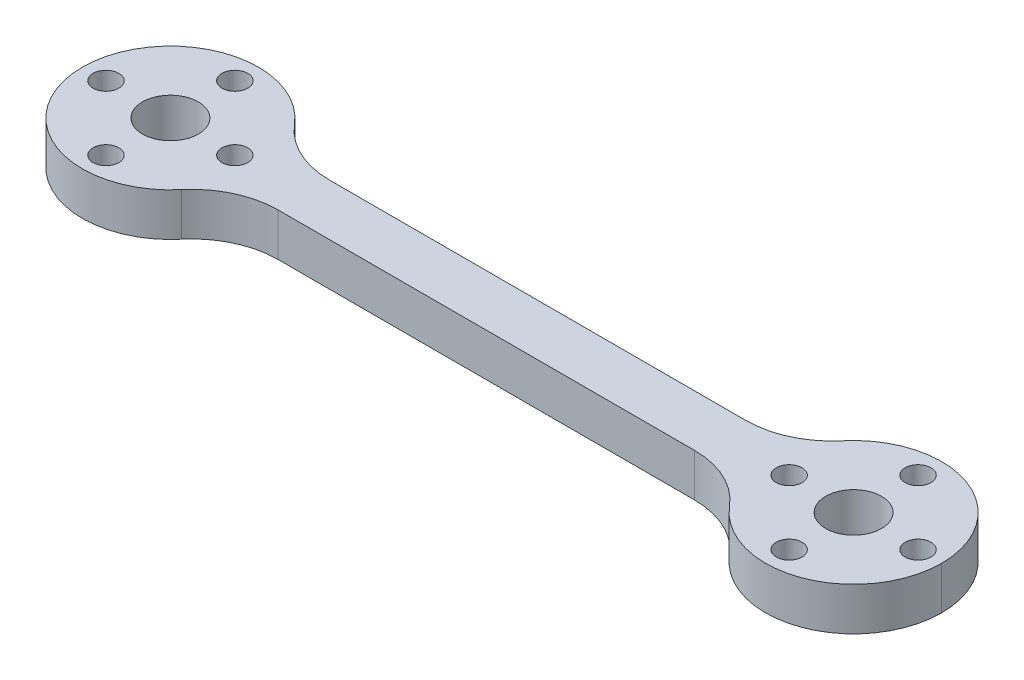
from build123d import *

# Parameters (mm, degrees)
SKETCH1_W           = 100
SKETCH1_H           = 20.5
SKETCH1_R           = 3.25
SKETCH1_R_2         = 1.5
BOSS_EXTRUDE1_DEPTH = 5
FILLET1_R           = 10.25
CUT_EXTRUDE1_DEPTH  = 10
FILLET2_R           = 10


with BuildPart() as part:
    # Sketch1 → Boss-Extrude1 (new body)
    with BuildSketch(Plane(origin=(0, 0, 0), x_dir=(1, 0, 0), z_dir=(0, 1, 0))):
        with Locations((50, 10.25)):
            Rectangle(SKETCH1_W, SKETCH1_H)
        with Locations(Location((10.25, 10.25, 0), (0, 0, 270))):
            Circle(SKETCH1_R, mode=Mode.SUBTRACT)
        with Locations(Location((17.75, 10.25, 0), (0, 0, 270))):
            Circle(SKETCH1_R_2, mode=Mode.SUBTRACT)
        with Locations(Location((10.25, 17.75, 0), (0, 0, 90))):
            Circle(SKETCH1_R_2, mode=Mode.SUBTRACT)
        with Locations(Location((10.25, 2.75, 0), (0, 0, 90))):
            Circle(SKETCH1_R_2, mode=Mode.SUBTRACT)
        with Locations(Location((2.75, 10.25, 0), (0, 0, 270))):
            Circle(SKETCH1_R_2, mode=Mode.SUBTRACT)
        with Locations(Location((82.25, 10.25, 0), (0, 0, 90))):
            Circle(SKETCH1_R_2, mode=Mode.SUBTRACT)
        with Locations(Location((89.75, 17.75, 0), (0, 0, 270))):
            Circle(SKETCH1_R_2, mode=Mode.SUBTRACT)
        with Locations(Location((89.75, 2.75, 0), (0, 0, 270))):
            Circle(SKETCH1_R_2, mode=Mode.SUBTRACT)
        with Locations(Location((97.25, 10.25, 0), (0, 0, 90))):
            Circle(SKETCH1_R_2, mode=Mode.SUBTRACT)
        with Locations(Location((89.75, 10.25, 0), (0, 0, 90))):
            Circle(SKETCH1_R, mode=Mode.SUBTRACT)
    extrude(amount=BOSS_EXTRUDE1_DEPTH)

    # Fillet1
    fillet1_edges = [part.edges().sort_by_distance(p)[0] for p in [
        (0, 2.5, 0),
        (0, 2.5, -20.5),
        (100, 2.5, -20.5),
        (100, 2.5, 0),
    ]]
    fillet(fillet1_edges, radius=FILLET1_R - 0.0001)  # a hair under: the kernel refuses the full size

    # Sketch2 → Cut-Extrude1 (cut)
    with BuildSketch(Plane(origin=(0, 5, 0), x_dir=(1, 0, 0), z_dir=(0, 1, 0))):
        with BuildLine():
            Line((20.051147892, 13.25), (79.948852108, 13.25))
            ThreePointArc((79.948852108, 13.25), (83.65440733, 18.490524862), (89.75, 20.5))
            Line((89.75, 20.5), (10.25, 20.5))
            ThreePointArc((10.25, 20.5), (16.34559267, 18.490524862), (20.051147892, 13.25))
        make_face()
        with BuildLine():
            Line((20.051147892, 7.25), (79.948852108, 7.25))
            ThreePointArc((79.948852108, 7.25), (83.65440733, 2.009475138), (89.75, 0))
            Line((89.75, 0), (10.25, 0))
            ThreePointArc((10.25, 0), (16.34559267, 2.009475138), (20.051147892, 7.25))
        make_face()
    extrude(amount=-CUT_EXTRUDE1_DEPTH, mode=Mode.SUBTRACT)

    # Fillet2
    fillet2_edges = [part.edges().sort_by_distance(p)[0] for p in [
        (20.051147892, 2.5, -13.25),
        (79.948852108, 2.5, -13.25),
        (79.948852108, 2.5, -7.25),
        (20.051147892, 2.5, -7.25),
    ]]
    fillet(fillet2_edges, radius=FILLET2_R)


solid = part.part
